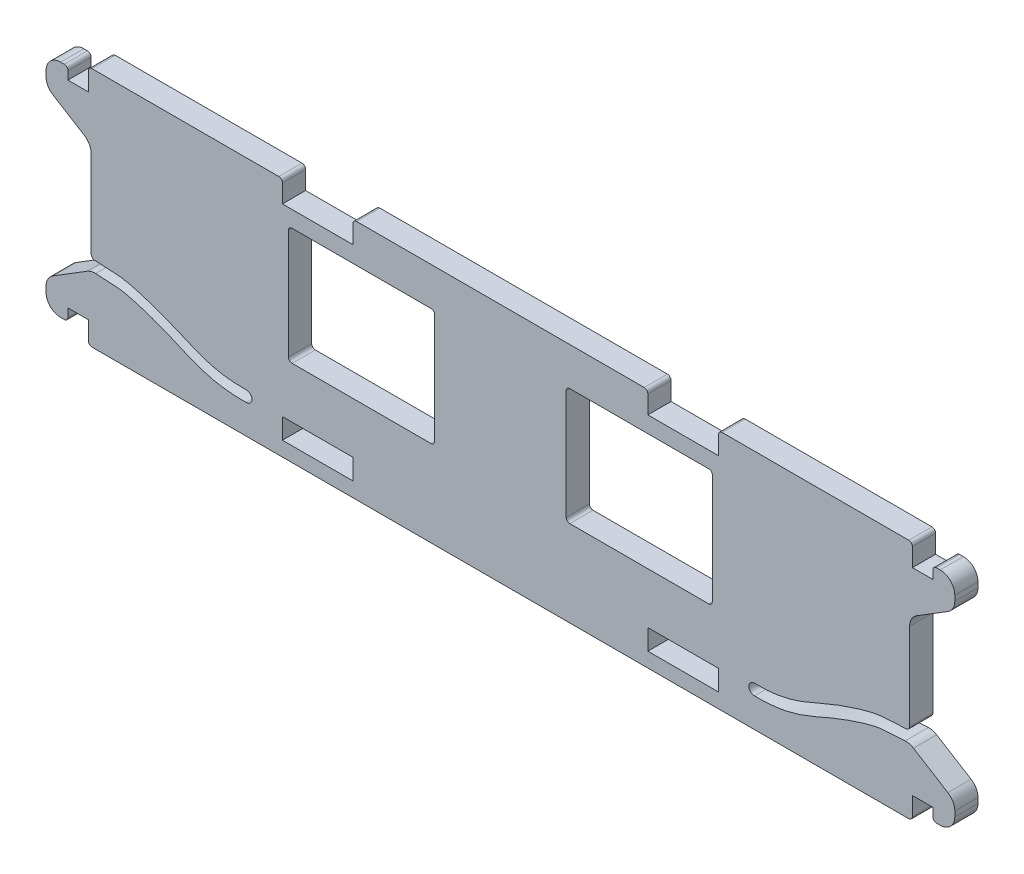
from build123d import *

# Parameters (mm, degrees)
SKETCH1_W           = 124.35
SKETCH1_H           = 33
BOSS_EXTRUDE1_DEPTH = 3.175
SKETCH2_W           = 9.65
SKETCH2_H           = 2.8
SKETCH2_H_2         = 3
CUT_EXTRUDE1_DEPTH  = 65.405444257
SKETCH4_W           = 2.8
SKETCH4_H           = 3
SKETCH4_W_2         = 6.175
SKETCH4_H_2         = 15
CUT_EXTRUDE2_DEPTH  = 65.405444257
SKETCH6_W           = 3
SKETCH6_H           = 1.375
CUT_EXTRUDE3_DEPTH  = 65.405444257
CUT_SWEEP1_DEPTH    = 3.175
SKETCH12_R          = 0.75
CUT_EXTRUDE6_DEPTH  = 65.405444385
CUT_EXTRUDE7_DEPTH  = 65.405444385
FILLET6_R           = 2
FILLET7_R           = 0.5
SKETCH15_W          = 20
SKETCH15_H          = 16
CUT_EXTRUDE9_DEPTH  = 65.405444385
FILLET9_R           = 0.5


# Read off the part's stored shape, not the designer's step: Cut-Sweep1
with BuildPart() as part:
    # Sketch1 → Boss-Extrude1 (new body)
    with BuildSketch(Plane.XY):
        Rectangle(SKETCH1_W, SKETCH1_H)
    extrude(amount=BOSS_EXTRUDE1_DEPTH)

    # Sketch2 → Cut-Extrude1 (cut, through all)
    with BuildSketch(Plane.XY.offset(3.175)):
        with Locations((-25, -13.1)):
            Rectangle(SKETCH2_W, SKETCH2_H)
        with Locations((25, -13.1)):
            Rectangle(SKETCH2_W, SKETCH2_H)
        with Locations((-25, 15)):
            Rectangle(SKETCH2_W, SKETCH2_H_2)
        with Locations((25, 15)):
            Rectangle(SKETCH2_W, SKETCH2_H_2)
    extrude(amount=-CUT_EXTRUDE1_DEPTH, mode=Mode.SUBTRACT)

    # Sketch4 → Cut-Extrude2 (cut, through all)
    with BuildSketch(Plane.XY.offset(3.175)):
        with Locations((-57.775, 15)):
            Rectangle(SKETCH4_W, SKETCH4_H)
        with Locations((-59.0875, 0)):
            Rectangle(SKETCH4_W_2, SKETCH4_H_2)
        with Locations((-57.775, -15)):
            Rectangle(SKETCH4_W, SKETCH4_H)
        with Locations((57.775, 15)):
            Rectangle(SKETCH4_W, SKETCH4_H)
        with Locations((59.0875, 0)):
            Rectangle(SKETCH4_W_2, SKETCH4_H_2)
        with Locations((57.775, -15)):
            Rectangle(SKETCH4_W, SKETCH4_H)
    extrude(amount=-CUT_EXTRUDE2_DEPTH, mode=Mode.SUBTRACT)

    # Sketch6 → Cut-Extrude3 (cut, through all)
    with BuildSketch(Plane.XY.offset(3.175)):
        with Locations((-60.675, 15.8125)):
            Rectangle(SKETCH6_W, SKETCH6_H)
        with Locations((-60.675, -15.8125)):
            Rectangle(SKETCH6_W, SKETCH6_H)
        with Locations((60.675, 15.8125)):
            Rectangle(SKETCH6_W, SKETCH6_H)
        with Locations((60.675, -15.8125)):
            Rectangle(SKETCH6_W, SKETCH6_H)
    extrude(amount=-CUT_EXTRUDE3_DEPTH, mode=Mode.SUBTRACT)

    # Cut-Sweep1 outline → Cut-Sweep1 (cut)
    with BuildSketch(Plane.XY):
        with BuildLine():
            add(Edge.make_bspline(
                [(-56, -6), (-55.016272395, -6.040912607), (-53.484317245, -6.110006936), (-52.10462272, -6.208217255), (-51.370216858, -6.312882143), (-50.849013323, -6.424427059), (-50.274077583, -6.562740427), (-49.507561658, -6.770408498), (-47.98416767, -7.234467607), (-46.535590196, -7.742954919), (-44.899823838, -8.383891144), (-43.265010906, -9.091671777), (-41.074137026, -10.055384808), (-38.357692762, -10.850187014), (-36.1078612, -11.027108547), (-34.793437631, -10.999002823)],
                knots=[0, 0, 0, 0, 0.052266667, 0.104533333, 0.1568, 0.188540911, 0.209066667, 0.261333333, 0.3136, 0.4368, 0.46346514, 0.56, 0.706666667, 0.853333333, 1, 1, 1, 1], degree=3))
            Line((-56, -6), (-56, -7.5))
            add(Edge.make_bspline(
                [(-56, -7.5), (-55.020423649, -7.540842864), (-53.496771007, -7.609797709), (-52.171479553, -7.70829789), (-51.569513747, -7.80075633), (-51.115986388, -7.900930823), (-50.592043829, -8.028791809), (-49.863497697, -8.22781936), (-48.398796638, -8.676488924), (-46.992197023, -9.172450468), (-45.412650318, -9.7933523), (-43.831176536, -10.480660701), (-41.561928867, -11.478467634), (-38.556226285, -12.350501385), (-36.110914304, -12.525218982), (-34.698750526, -12.49601129)],
                knots=[0, 0, 0, 0, 0.052266667, 0.104533333, 0.1568, 0.188540911, 0.209066667, 0.261333333, 0.3136, 0.4368, 0.46346514, 0.56, 0.706666667, 0.853333333, 1, 1, 1, 1], degree=3))
            Line((-34.698750526, -12.49601129), (-34.793437631, -10.999002823))
        make_face()
    cut_sweep1 = extrude(amount=CUT_SWEEP1_DEPTH, mode=Mode.SUBTRACT)

    # Mirror1: Cut-Sweep1 across plane
    add(cut_sweep1.mirror(Plane.ZY), mode=Mode.SUBTRACT)

    # Sketch12 → Cut-Extrude6 (cut, through all)
    with BuildSketch(Plane.XY.offset(3.175)):
        with Locations((-34.746094079, -11.747507056)):
            Circle(SKETCH12_R)
        with Locations((34.746094079, -11.747507056)):
            Circle(SKETCH12_R)
    extrude(amount=-CUT_EXTRUDE6_DEPTH, mode=Mode.SUBTRACT)

    # Sketch13 → Cut-Extrude7 (cut, through all)
    with BuildSketch(Plane.XY.offset(3.175)):
        Polygon((-56, 7.5), (-62.175, 11.3125), (-62.175, 7.5), align=None)
        Polygon((-56, -7.5), (-62.175, -11.3125), (-62.175, -7.5), align=None)
        Polygon((56, 7.5), (62.175, 11.3125), (62.175, 7.5), align=None)
        Polygon((56, -7.5), (62.175, -11.3125), (62.175, -7.5), align=None)
    extrude(amount=-CUT_EXTRUDE7_DEPTH, mode=Mode.SUBTRACT)

    # Fillet6
    fillet6_edges = [part.edges().sort_by_distance(p)[0] for p in [
        (62.175, -15.125, 1.5875),
        (62.175, -11.3125, 1.5875),
        (56, -7.5, 1.5875),
        (56, 7.5, 1.5875),
        (62.175, 11.3125, 1.5875),
        (62.175, 15.125, 1.5875),
        (-62.175, -15.125, 1.5875),
        (-62.175, -11.3125, 1.5875),
        (-56, -7.5, 1.5875),
        (-62.175, 15.125, 1.5875),
        (-62.175, 11.3125, 1.5875),
        (-56, 7.5, 1.5875),
    ]]
    fillet(fillet6_edges, radius=FILLET6_R)

    # Fillet7
    fillet7_edges = [part.edges().sort_by_distance(p)[0] for p in [
        (59.175, 15.125, 1.5875),
        (59.175, -15.125, 1.5875),
        (-59.175, -15.125, 1.5875),
        (-59.175, 15.125, 1.5875),
        (20.175, 16.5, 1.5875),
        (29.825, 16.5, 1.5875),
        (-20.175, 16.5, 1.5875),
        (-29.825, 16.5, 1.5875),
        (56.375, -16.5, 1.5875),
        (56, -6, 1.5875),
        (56.375, 16.5, 1.5875),
        (-56.375, 16.5, 1.5875),
        (-56.375, -16.5, 1.5875),
        (-56, -6, 1.5875),
    ]]
    fillet(fillet7_edges, radius=FILLET7_R)

    # Sketch15 → Cut-Extrude9 (cut, through all)
    with BuildSketch(Plane.XY.offset(3.175)):
        with Locations((-19, 3.275)):
            Rectangle(SKETCH15_W, SKETCH15_H)
        with Locations((19, 3.275)):
            Rectangle(SKETCH15_W, SKETCH15_H)
    extrude(amount=-CUT_EXTRUDE9_DEPTH, mode=Mode.SUBTRACT)

    # Fillet9
    fillet9_edges = [part.edges().sort_by_distance(p)[0] for p in [
        (-29, -4.725, 1.5875),
        (-29, 11.275, 1.5875),
        (-9, 11.275, 1.5875),
        (-9, -4.725, 1.5875),
        (9, -4.725, 1.5875),
        (9, 11.275, 1.5875),
        (29, 11.275, 1.5875),
        (29, -4.725, 1.5875),
    ]]
    fillet(fillet9_edges, radius=FILLET9_R)


solid = part.part
